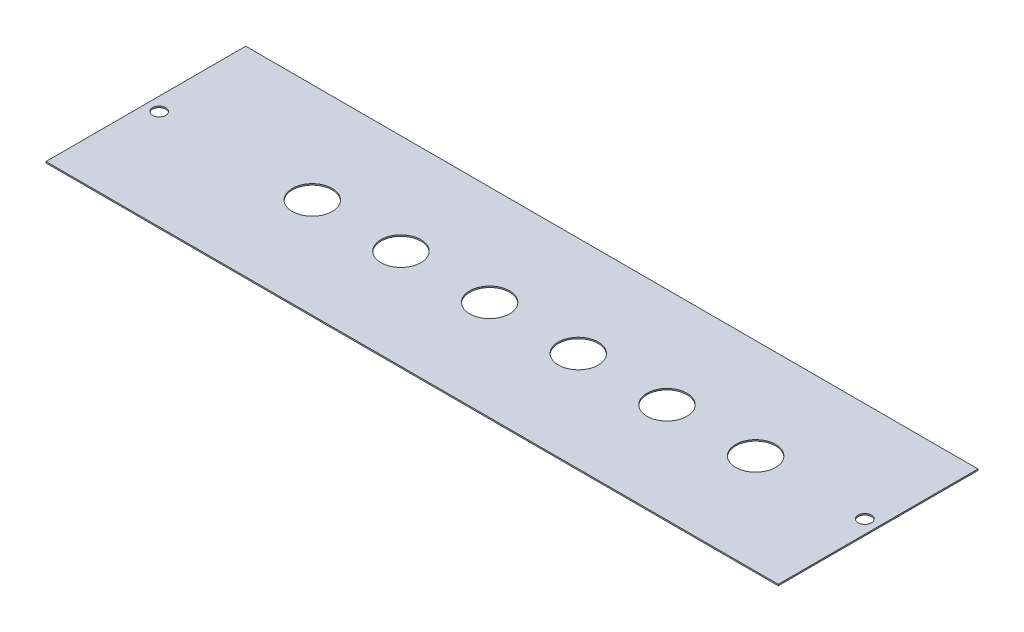
from build123d import *

# Parameters (mm, degrees)
SKETCH1_W          = 550
SKETCH1_H          = 150
BASE_FLANGE1_DEPTH = 1
SKETCH3_R          = 5
CUT_EXTRUDE1_DEPTH = 1
SKETCH4_R          = 15
CUT_EXTRUDE2_DEPTH = 1
LPATTERN1_COUNT    = 6
LPATTERN1_PITCH    = 66.6


# Sheet-metal steps are written as plain solids
with BuildPart() as part:
    # Sketch1 → Base-Flange1 (new body)
    with BuildSketch(Plane(origin=(0, 0, 0), x_dir=(1, 0, 0), z_dir=(0, 1, 0))):
        Rectangle(SKETCH1_W, SKETCH1_H)
    extrude(amount=-BASE_FLANGE1_DEPTH)

    # Sketch3 → Cut-Extrude1 (cut)
    with BuildSketch(Plane(origin=(0, 0, 0), x_dir=(1, 0, 0), z_dir=(0, 1, 0))):
        with Locations(Location((-265, 0, 0), (0, 0, 270))):
            Circle(SKETCH3_R)
        with Locations(Location((265, 0, 0), (0, 0, 270))):
            Circle(SKETCH3_R)
    extrude(amount=-CUT_EXTRUDE1_DEPTH, mode=Mode.SUBTRACT)

    # Sketch4 → Cut-Extrude2 (cut)
    with BuildSketch(Plane.XZ.offset(1)):
        with Locations(Location((-150, 0, 0), (0, 0, 270))):
            Circle(SKETCH4_R)
    cut_extrude2 = extrude(amount=-CUT_EXTRUDE2_DEPTH, mode=Mode.SUBTRACT)

    # LPattern1: Cut-Extrude2 ×6
    with Locations(*[(i * LPATTERN1_PITCH, 0, 0) for i in range(1, LPATTERN1_COUNT)]):
        add(cut_extrude2, mode=Mode.SUBTRACT)


solid = part.part
